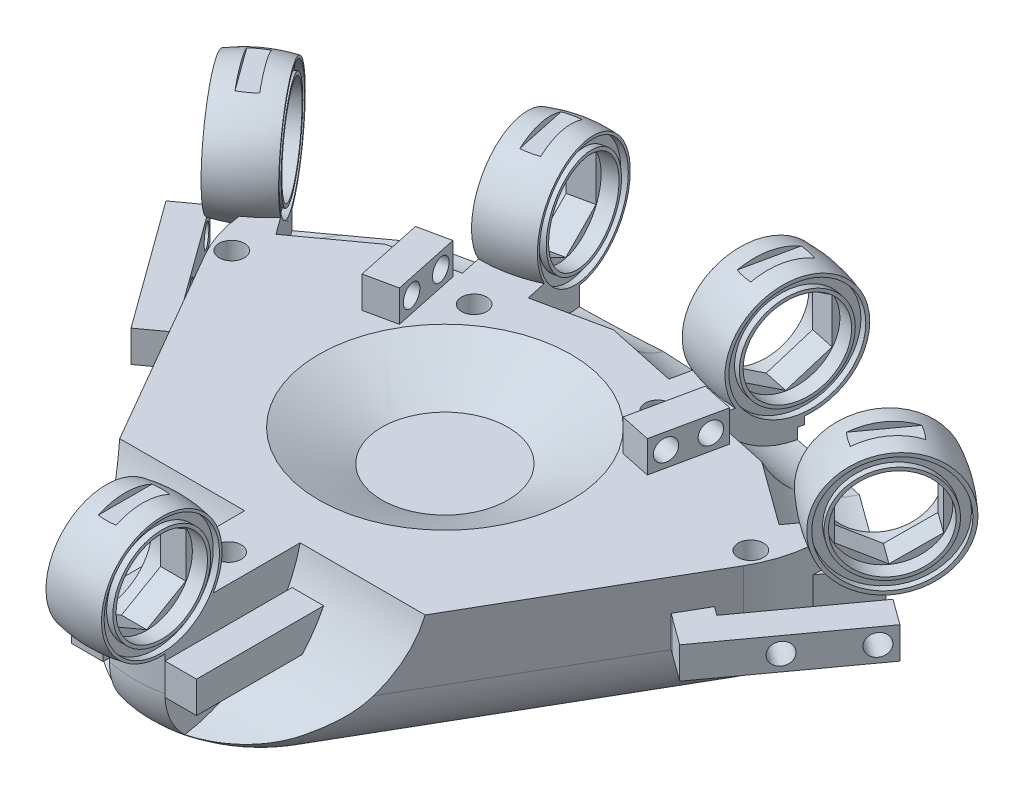
from build123d import *

# Parameters (mm, degrees)
BOSS_EXTRUDE1_DEPTH       = 20
FILLET1_R                 = 10
CUT_EXTRUDE1_DEPTH        = 15
CUT_EXTRUDE1_DEPTH_BACK   = 15
SKETCH6_R                 = 7.25
SKETCH12_R                = 12.5
CUT_EXTRUDE4_DEPTH        = 15
SKETCH13_R                = 9.15
SKETCH13_R_2              = 7.75
CUT_EXTRUDE5_DEPTH        = 1
CUT_EXTRUDE6_START        = -1
SKETCH14_R                = 9.15
SKETCH14_R_2              = 7.75
CUT_EXTRUDE6_DEPTH        = 1
SKETCH18_R                = 7.25
CUT_EXTRUDE7_DEPTH        = 10
SKETCH19_R                = 12.5
CUT_EXTRUDE8_DEPTH        = 15
CUT_EXTRUDE9_START        = 15
SKETCH20_R                = 12.5
CUT_EXTRUDE9_DEPTH        = 15
CUT_EXTRUDE10_DEPTH       = 10
CUT_EXTRUDE10_DEPTH_BACK  = 10
SKETCH22_R                = 7.25
SKETCH23_R                = 9.15
SKETCH23_R_2              = 7.75
CUT_EXTRUDE11_DEPTH       = 1
SKETCH24_R                = 9.45
SKETCH24_R_2              = 8.05
CUT_EXTRUDE12_DEPTH       = 1
SKETCH25_R                = 12.5
CUT_EXTRUDE13_DEPTH       = 15
CUT_EXTRUDE14_START       = 15
SKETCH26_R                = 12.5
CUT_EXTRUDE14_DEPTH       = 15
SKETCH27_R                = 9.15
SKETCH27_R_2              = 7.75
CUT_EXTRUDE15_DEPTH       = 1
SKETCH28_R                = 9.45
SKETCH28_R_2              = 8.05
CUT_EXTRUDE16_DEPTH       = 1
SKETCH31_R                = 9.15
SKETCH31_R_2              = 7.75
CUT_EXTRUDE17_DEPTH       = 1
CUT_EXTRUDE18_DEPTH       = 10
CUT_EXTRUDE18_DEPTH_BACK  = 10
SKETCH32_R                = 7.25
CUT_EXTRUDE19_START       = -1
SKETCH33_R                = 9.15
SKETCH33_R_2              = 7.75
CUT_EXTRUDE19_DEPTH       = 1
SKETCH36_R                = 12.5
CUT_EXTRUDE21_DEPTH       = 15
CUT_EXTRUDE22_DEPTH       = 10
CUT_EXTRUDE22_DEPTH_BACK  = 10
SKETCH37_R                = 7.25
SKETCH38_R                = 9.15
SKETCH38_R_2              = 7.75
CUT_EXTRUDE23_DEPTH       = 1
SKETCH39_R                = 9.45
SKETCH39_R_2              = 8.05
CUT_EXTRUDE24_DEPTH       = 1
SKETCH40_R                = 22.5
CUT_EXTRUDE25_DEPTH       = 20
SKETCH44_R                = 2
CUT_EXTRUDE27_DEPTH       = 20
SKETCH47_W                = 32.930294651
SKETCH47_H                = 15.901630763
CUT_EXTRUDE28_DEPTH       = 10
SKETCH48_W                = 41.253065482
SKETCH48_H                = 17.246321063
CUT_EXTRUDE29_DEPTH       = 10
SKETCH49_W                = 33.439654436
SKETCH49_H                = 19.134308239
CUT_EXTRUDE30_DEPTH       = 10
SKETCH50_W                = 28.57046848
SKETCH50_H                = 25.068795464
CUT_EXTRUDE31_DEPTH       = 10
SKETCH51_W                = 15
SKETCH51_H                = 2.5
BOSS_EXTRUDE2_DEPTH       = 40
SKETCH56_W                = 5
SKETCH56_H                = 5
BOSS_EXTRUDE6_DEPTH       = 25
SKETCH57_W                = 5
SKETCH57_H                = 5
BOSS_EXTRUDE7_DEPTH       = 5
SKETCH59_R                = 1.7
CUT_EXTRUDE33_DEPTH       = 5
BOSS_EXTRUDE10_DEPTH      = 2
BOSS_EXTRUDE10_DEPTH_BACK = 2
SKETCH62_R                = 7.25
BOSS_EXTRUDE11_DEPTH      = 2
BOSS_EXTRUDE11_DEPTH_BACK = 2
SKETCH63_R                = 7.25
BOSS_EXTRUDE12_DEPTH      = 2
BOSS_EXTRUDE12_DEPTH_BACK = 2
SKETCH64_R                = 7.25
CUT_EXTRUDE26_START       = 20
SKETCH41_R                = 22.5
CUT_EXTRUDE26_DEPTH       = 20
SKETCH60_W                = 5
SKETCH60_H                = 5
BOSS_EXTRUDE9_DEPTH       = 25
SKETCH65_R                = 1.5
CUT_EXTRUDE35_DEPTH       = 5
BOSS_EXTRUDE13_DEPTH      = 5
SKETCH67_R                = 1.7
CUT_EXTRUDE36_DEPTH       = 5
SKETCH61_R                = 1.5
CUT_EXTRUDE34_DEPTH       = 10
BOSS_EXTRUDE15_DEPTH      = 10
SKETCH71_W                = 5
SKETCH71_H                = 5
BOSS_EXTRUDE16_DEPTH      = 25
SKETCH72_W                = 5
SKETCH72_H                = 5
BOSS_EXTRUDE17_DEPTH      = 5
SKETCH73_R                = 1.7
CUT_EXTRUDE37_DEPTH       = 5
BOSS_EXTRUDE18_DEPTH      = 2
BOSS_EXTRUDE18_DEPTH_BACK = 2
SKETCH74_R                = 7.25
BOSS_EXTRUDE19_DEPTH      = 2
BOSS_EXTRUDE19_DEPTH_BACK = 2
SKETCH75_R                = 7.25
SKETCH77_W                = 2.8
SKETCH77_H                = 10
CUT_EXTRUDE38_DEPTH       = 1


with BuildPart() as part:
    # Sketch1 → Boss-Extrude1 (new body)
    with BuildSketch(Plane(origin=(0, 0, 0), x_dir=(1, 0, 0), z_dir=(0, 1, 0))):
        with BuildLine():
            Line((34.641016151, 0), (85.358983849, 0))
            ThreePointArc((85.358983849, 0), (102.679491924, -10), (102.679491924, -30))
            Line((102.679491924, -30), (77.320508076, -73.923048454))
            ThreePointArc((77.320508076, -73.923048454), (60, -83.923048454), (42.679491924, -73.923048454))
            Line((42.679491924, -73.923048454), (17.320508076, -30))
            ThreePointArc((17.320508076, -30), (17.320508076, -10), (34.641016151, 0))
        make_face()
    extrude(amount=BOSS_EXTRUDE1_DEPTH)

    # Fillet1
    fillet1_edges = [part.edges().sort_by_distance(p)[0] for p in [
        (30, 0, 51.961524227),
        (17.320508076, 0, 10),
        (60, 0, 0),
        (102.679491924, 0, 10),
        (90, 0, 51.961524227),
        (60, 0, 83.923048454),
    ]]
    fillet(fillet1_edges, radius=FILLET1_R)

    # Cut-Loft1: read off the stored shape, not the designer's step
    # Cut-Loft1: loft between two sections, ruled curve by curve
    cut_loft1_from = [
        Edge.make_bspline([(50.072678412, 15, 33.437568563), (47.665783236, 15, 53.292211738), (67.520426411, 15, 55.699106915), (69.927321588, 15, 35.844463739), (72.334216764, 15, 15.989820564), (52.479573589, 15, 13.582925388), (50.072678412, 15, 33.437568563)], [0, 0, 0, 0, 0.5, 0.5, 0.5, 1, 1, 1, 1], 3, [1, 0.333333333, 0.333333333, 1, 0.333333333, 0.333333333, 1]),
    ]
    cut_loft1_to = [
        Edge.make_bspline([(41.957320813, 20, 26.011895238), (24.699078985, 20, 62.097253612), (60.78443736, 20, 79.35549544), (78.042679187, 20, 43.270137065), (95.300921015, 20, 7.18477869), (59.21556264, 20, -10.073463137), (41.957320813, 20, 26.011895238)], [0, 0, 0, 0, 0.5, 0.5, 0.5, 1, 1, 1, 1], 3, [1, 0.333333333, 0.333333333, 1, 0.333333333, 0.333333333, 1]),
    ]
    cut_loft1 = Solid(Shell([*[Face.make_surface_from_curves(cut_loft1_from[k], cut_loft1_to[k]) for k in range(1)], Face(Wire(cut_loft1_from)), Face(Wire(cut_loft1_to))]))
    add(cut_loft1, mode=Mode.SUBTRACT)

    # Sketch5 → Revolve1 (revolve)
    with BuildSketch(Plane(origin=(22.309350243, 0, 5.797401883), x_dir=(-0.8090169943749479, 0, 0.5877852522924724), z_dir=(-0.5877852522924725, 0, -0.809016994374948))):
        with BuildLine():
            Line((11.028726698, 25), (19.828726698, 25))
            Line((19.828726698, 25), (19.828726698, 34.539392014))
            add(Edge.make_bspline(
                [(19.828726698, 34.539392014), (15.428726698, 35.441382878), (11.028726698, 34.539392014)],
                knots=[1.272475926, 1.272475926, 1.272475926, 1.869116728, 1.869116728, 1.869116728], degree=2, weights=[1, 0.955831497, 1]))
            Line((11.028726698, 34.539392014), (11.028726698, 25))
        make_face()
    revolve(axis=Axis((13.386922918, 25, 12.279924788), (-0.809016994374948, 0, 0.5877852522924724)))

    # Sketch6 → Cut-Extrude1 (cut, two sides: drawn at the far end of the back side and taken through both)
    with BuildSketch(Plane(origin=(-0.637271219, 0, 0.463004642), x_dir=(-0.5877852522924727, 0, -0.8090169943749477), z_dir=(0.8090169943749477, 0, -0.5877852522924727)).offset(-CUT_EXTRUDE1_DEPTH_BACK)):
        with Locations(Location((-17.803303708, 25, 0), (0, 0, 223.602818973))):
            Circle(SKETCH6_R)
    extrude(amount=CUT_EXTRUDE1_DEPTH + CUT_EXTRUDE1_DEPTH_BACK, mode=Mode.SUBTRACT)

    # Sketch12 → Cut-Extrude4 (cut)
    with BuildSketch(Plane(origin=(2.922403557, 0, -2.123250468), x_dir=(-0.5877852522924724, 0, -0.809016994374948), z_dir=(0.809016994374948, 0, -0.5877852522924724))):
        with Locations((-17.803303708, 25)):
            Circle(SKETCH12_R)
    extrude(amount=CUT_EXTRUDE4_DEPTH, mode=Mode.SUBTRACT)

    # Sketch13 → Cut-Extrude5 (cut)
    with BuildSketch(Plane(origin=(-4.196945994, 0, 3.049259752), x_dir=(0.5877852522924724, 0, 0.809016994374948), z_dir=(-0.809016994374948, 0, 0.5877852522924724))):
        with Locations((17.803303708, 25)):
            Circle(SKETCH13_R)
        with Locations((17.803303708, 25)):
            Circle(SKETCH13_R_2, mode=Mode.SUBTRACT)
    extrude(amount=-CUT_EXTRUDE5_DEPTH, mode=Mode.SUBTRACT)

    # Sketch14 → Cut-Extrude6 (cut)
    with BuildSketch(Plane(origin=(2.922403557, 0, -2.123250468), x_dir=(-0.5877852522924724, 0, -0.809016994374948), z_dir=(0.809016994374948, 0, -0.5877852522924724)).offset(CUT_EXTRUDE6_START)):
        with Locations(Location((-17.803303708, 25, 0), (0, 0, 180))):
            Circle(SKETCH14_R)
        with Locations(Location((-17.803303708, 25, 0), (0, 0, 180))):
            Circle(SKETCH14_R_2, mode=Mode.SUBTRACT)
    extrude(amount=CUT_EXTRUDE6_DEPTH, mode=Mode.SUBTRACT)

    # Sketch17 → Revolve3 (revolve)
    with BuildSketch(Plane(origin=(1.822531149, 0, 8.574334919), x_dir=(-0.9781476007338061, 0, 0.20791169081775784), z_dir=(-0.20791169081775784, 0, -0.9781476007338061))):
        with BuildLine():
            Line((-45.640273141, 25), (-36.840273141, 25))
            Line((-36.840273141, 25), (-36.840273141, 34.560102277))
            add(Edge.make_bspline(
                [(-36.840273141, 34.560102277), (-41.240273141, 35.460139138), (-45.640273141, 34.560102277)],
                knots=[1.273084632, 1.273084632, 1.273084632, 1.868508022, 1.868508022, 1.868508022], degree=2, weights=[1, 0.956010228, 1]))
            Line((-45.640273141, 34.560102277), (-45.640273141, 25))
        make_face()
    revolve(axis=Axis((46.465454819, 25, -0.91481144), (-0.978147600733806, 0, 0.20791169081775793)))

    # Sketch18 → Cut-Extrude7 (cut)
    with BuildSketch(Plane(origin=(36.035224784, 0, -7.659523479), x_dir=(0.2079116908177577, 0, 0.978147600733806), z_dir=(-0.978147600733806, 0, 0.2079116908177577))):
        with Locations(Location((8.765890661, 25, 0), (0, 0, 316.397181027))):
            Circle(SKETCH18_R)
    extrude(amount=-CUT_EXTRUDE7_DEPTH, mode=Mode.SUBTRACT)

    # Sketch19 → Cut-Extrude8 (cut)
    with BuildSketch(Plane(origin=(44.64292367, 0, -9.489146358), x_dir=(-0.2079116908177577, 0, -0.978147600733806), z_dir=(0.978147600733806, 0, -0.2079116908177577))):
        with Locations((-8.765890661, 25)):
            Circle(SKETCH19_R)
    extrude(amount=CUT_EXTRUDE8_DEPTH, mode=Mode.SUBTRACT)

    # Sketch20 → Cut-Extrude9 (cut)
    with BuildSketch(Plane(origin=(36.035224784, 0, -7.659523479), x_dir=(0.2079116908177577, 0, 0.978147600733806), z_dir=(-0.978147600733806, 0, 0.2079116908177577)).offset(CUT_EXTRUDE9_START)):
        with Locations((8.765890661, 25)):
            Circle(SKETCH20_R)
    extrude(amount=-CUT_EXTRUDE9_DEPTH, mode=Mode.SUBTRACT)

    # Sketch21 → Revolve4 (revolve)
    with BuildSketch(Plane(origin=(3.364741393, 0, -15.829863666), x_dir=(-0.9781476007338051, 0, -0.2079116908177618), z_dir=(0.2079116908177618, 0, -0.9781476007338051))):
        with BuildLine():
            Line((-80.537438947, 25), (-71.737438947, 25))
            Line((-71.737438947, 25), (-71.737438947, 34.677856787))
            add(Edge.make_bspline(
                [(-71.737438947, 34.677856787), (-76.137438947, 35.332866274), (-80.537438947, 34.677856787)],
                knots=[1.316281954, 1.316281954, 1.316281954, 1.8253107, 1.8253107, 1.8253107], degree=2, weights=[1, 0.967785679, 1]))
            Line((-80.537438947, 34.677856787), (-80.537438947, 25))
        make_face()
    revolve(axis=Axis((82.142244068, 25, 0.91481144), (-0.9781476007338051, 0, -0.20791169081776173)))

    # Sketch22 → Cut-Extrude10 (cut, two sides: drawn at the far end of the back side and taken through both)
    with BuildSketch(Plane(origin=(74.473653232, 0, 15.829863666), x_dir=(0.20791169081776434, 0, -0.9781476007338046), z_dir=(0.9781476007338046, 0, 0.20791169081776434)).offset(-CUT_EXTRUDE10_DEPTH_BACK)):
        with Locations(Location((16.183512237, 25, 0), (0, 0, 223.602818973))):
            Circle(SKETCH22_R)
    extrude(amount=CUT_EXTRUDE10_DEPTH + CUT_EXTRUDE10_DEPTH_BACK, mode=Mode.SUBTRACT)

    # Sketch23 → Cut-Extrude11 (cut)
    with BuildSketch(Plane(origin=(78.777502675, 0, 16.744675106), x_dir=(0.20791169081776179, 0, -0.9781476007338052), z_dir=(0.9781476007338052, 0, 0.20791169081776179))):
        with Locations((16.183512237, 25)):
            Circle(SKETCH23_R)
        with Locations((16.183512237, 25)):
            Circle(SKETCH23_R_2, mode=Mode.SUBTRACT)
    extrude(amount=-CUT_EXTRUDE11_DEPTH, mode=Mode.SUBTRACT)

    # Sketch24 → Cut-Extrude12 (cut)
    with BuildSketch(Plane(origin=(70.169803789, 0, 14.915052226), x_dir=(-0.20791169081776179, 0, 0.9781476007338052), z_dir=(-0.9781476007338052, 0, -0.20791169081776179))):
        with Locations((-16.183512237, 25)):
            Circle(SKETCH24_R)
        with Locations((-16.183512237, 25)):
            Circle(SKETCH24_R_2, mode=Mode.SUBTRACT)
    extrude(amount=-CUT_EXTRUDE12_DEPTH, mode=Mode.SUBTRACT)

    # Sketch25 → Cut-Extrude13 (cut)
    with BuildSketch(Plane(origin=(78.777502675, 0, 16.744675106), x_dir=(0.20791169081776179, 0, -0.9781476007338052), z_dir=(0.9781476007338052, 0, 0.20791169081776179))):
        with Locations((16.183512237, 25)):
            Circle(SKETCH25_R)
    extrude(amount=CUT_EXTRUDE13_DEPTH, mode=Mode.SUBTRACT)

    # Sketch26 → Cut-Extrude14 (cut)
    with BuildSketch(Plane(origin=(70.169803789, 0, 14.915052226), x_dir=(-0.20791169081776179, 0, 0.9781476007338052), z_dir=(-0.9781476007338052, 0, -0.20791169081776179)).offset(CUT_EXTRUDE14_START)):
        with Locations((-16.183512237, 25)):
            Circle(SKETCH26_R)
    extrude(amount=-CUT_EXTRUDE14_DEPTH, mode=Mode.SUBTRACT)

    # Sketch27 → Cut-Extrude15 (cut)
    with BuildSketch(Plane(origin=(44.64292367, 0, -9.489146358), x_dir=(-0.2079116908177577, 0, -0.978147600733806), z_dir=(0.978147600733806, 0, -0.2079116908177577))):
        with Locations((-8.765890661, 25)):
            Circle(SKETCH27_R)
        with Locations((-8.765890661, 25)):
            Circle(SKETCH27_R_2, mode=Mode.SUBTRACT)
    extrude(amount=-CUT_EXTRUDE15_DEPTH, mode=Mode.SUBTRACT)

    # Sketch28 → Cut-Extrude16 (cut)
    with BuildSketch(Plane(origin=(36.035224784, 0, -7.659523479), x_dir=(0.2079116908177577, 0, 0.978147600733806), z_dir=(-0.978147600733806, 0, 0.2079116908177577))):
        with Locations((8.765890661, 25)):
            Circle(SKETCH28_R)
        with Locations((8.765890661, 25)):
            Circle(SKETCH28_R_2, mode=Mode.SUBTRACT)
    extrude(amount=-CUT_EXTRUDE16_DEPTH, mode=Mode.SUBTRACT)

    # Sketch29 → Revolve5 (revolve)
    with BuildSketch(Plane(origin=(30.994460976, 0, -42.660215722), x_dir=(-0.8090169943749453, 0, -0.5877852522924761), z_dir=(0.587785252292476, 0, -0.8090169943749452))):
        with BuildLine():
            Line((-102.269749871, 25), (-93.469749871, 25))
            Line((-93.469749871, 25), (-93.469749871, 34.726608055))
            add(Edge.make_bspline(
                [(-93.469749871, 34.726608055), (-97.869749871, 35.281076346), (-102.269749871, 34.726608055)],
                knots=[1.336426181, 1.336426181, 1.336426181, 1.805166473, 1.805166473, 1.805166473], degree=2, weights=[1, 0.972660805, 1]))
            Line((-102.269749871, 34.726608055), (-102.269749871, 25))
        make_face()
    revolve(axis=Axis((113.732426632, 25, 17.452435008), (-0.8090169943749456, 0, -0.5877852522924758)))

    # Sketch31 → Cut-Extrude17 (cut)
    with BuildSketch(Plane(origin=(82.737965656, 0, 60.11265073), x_dir=(0.5877852522924765, 0, -0.8090169943749451), z_dir=(0.8090169943749451, 0, 0.5877852522924765))):
        with Locations((52.730926567, 25)):
            Circle(SKETCH31_R)
        with Locations((52.730926567, 25)):
            Circle(SKETCH31_R_2, mode=Mode.SUBTRACT)
    extrude(amount=-CUT_EXTRUDE17_DEPTH, mode=Mode.SUBTRACT)

    # Sketch32 → Cut-Extrude18 (cut, two sides: drawn at the far end of the back side and taken through both)
    with BuildSketch(Plane(origin=(79.178290881, 0, 57.52639562), x_dir=(0.5877852522924766, 0, -0.8090169943749451), z_dir=(0.8090169943749451, 0, 0.5877852522924766)).offset(-CUT_EXTRUDE18_DEPTH_BACK)):
        with Locations(Location((52.730926567, 25, 0), (0, 0, 180))):
            Circle(SKETCH32_R)
    extrude(amount=CUT_EXTRUDE18_DEPTH + CUT_EXTRUDE18_DEPTH_BACK, mode=Mode.SUBTRACT)

    # Sketch33 → Cut-Extrude19 (cut)
    with BuildSketch(Plane(origin=(75.618616106, 0, 54.94014051), x_dir=(-0.5877852522924765, 0, 0.8090169943749451), z_dir=(-0.8090169943749451, 0, -0.5877852522924765)).offset(CUT_EXTRUDE19_START)):
        with Locations(Location((-52.730926567, 25, 0), (0, 0, 180))):
            Circle(SKETCH33_R)
        with Locations(Location((-52.730926567, 25, 0), (0, 0, 180))):
            Circle(SKETCH33_R_2, mode=Mode.SUBTRACT)
    extrude(amount=CUT_EXTRUDE19_DEPTH, mode=Mode.SUBTRACT)

    # Sketch34 → Revolve6 (revolve)
    with BuildSketch(Plane.XY.offset(83.923048454)):
        with BuildLine():
            Line((55.6, 25), (64.4, 25))
            Line((64.4, 25), (64.4, 34.560102277))
            add(Edge.make_bspline(
                [(64.4, 34.560102277), (60, 35.460139138), (55.6, 34.560102277)],
                knots=[1.273084632, 1.273084632, 1.273084632, 1.868508022, 1.868508022, 1.868508022], degree=2, weights=[1, 0.956010228, 1]))
            Line((55.6, 34.560102277), (55.6, 25))
        make_face()
    revolve(axis=Axis((55.6, 25, 83.923048454), (1, 0, 0)))

    # Sketch36 → Cut-Extrude21 (cut)
    with BuildSketch(Plane(origin=(75.618616106, 0, 54.94014051), x_dir=(-0.5877852522924765, 0, 0.8090169943749451), z_dir=(-0.8090169943749451, 0, -0.5877852522924765))):
        with Locations((-52.730926567, 25)):
            Circle(SKETCH36_R)
    extrude(amount=CUT_EXTRUDE21_DEPTH, mode=Mode.SUBTRACT)

    # Sketch37 → Cut-Extrude22 (cut, two sides: drawn at the far end of the back side and taken through both)
    with BuildSketch(Plane(origin=(60, 0, 0), x_dir=(0, 0, -1), z_dir=(1, 0, 0)).offset(-CUT_EXTRUDE22_DEPTH_BACK)):
        with Locations(Location((-83.923048454, 25, 0), (0, 0, 291.690031176))):
            Circle(SKETCH37_R)
    extrude(amount=CUT_EXTRUDE22_DEPTH + CUT_EXTRUDE22_DEPTH_BACK, mode=Mode.SUBTRACT)

    # Sketch38 → Cut-Extrude23 (cut)
    with BuildSketch(Plane(origin=(64.4, 0, 0), x_dir=(0, 0, -1), z_dir=(1, 0, 0))):
        with Locations((-83.923048454, 25)):
            Circle(SKETCH38_R)
        with Locations((-83.923048454, 25)):
            Circle(SKETCH38_R_2, mode=Mode.SUBTRACT)
    extrude(amount=-CUT_EXTRUDE23_DEPTH, mode=Mode.SUBTRACT)

    # Sketch39 → Cut-Extrude24 (cut)
    with BuildSketch(Plane.ZY.offset(-55.6)):
        with Locations((83.923048454, 25)):
            Circle(SKETCH39_R)
        with Locations((83.923048454, 25)):
            Circle(SKETCH39_R_2, mode=Mode.SUBTRACT)
    extrude(amount=-CUT_EXTRUDE24_DEPTH, mode=Mode.SUBTRACT)

    # Sketch40 → Cut-Extrude25 (cut)
    with BuildSketch(Plane.ZY.offset(-55.6)):
        with Locations((83.923048454, 25)):
            Circle(SKETCH40_R)
    extrude(amount=CUT_EXTRUDE25_DEPTH, mode=Mode.SUBTRACT)

    # Sketch44 → Cut-Extrude27 (cut)
    with BuildSketch(Plane(origin=(0, 20, 0), x_dir=(1, 0, 0), z_dir=(0, 1, 0))):
        with Locations(Location((18.85503234, -27.291858848, 0), (0, 0, 270))):
            Circle(SKETCH44_R)
        with Locations(Location((45.446181643, -15.452716403, 0), (0, 0, 270))):
            Circle(SKETCH44_R)
        with Locations(Location((74.553818357, -15.452716403, 0), (0, 0, 270))):
            Circle(SKETCH44_R)
        with Locations(Location((101.14496766, -27.291858848, 0), (0, 0, 270))):
            Circle(SKETCH44_R)
        with Locations(Location((60, -68.923048454, 0), (0, 0, 270))):
            Circle(SKETCH44_R)
    extrude(amount=-CUT_EXTRUDE27_DEPTH, mode=Mode.SUBTRACT)

    # Sketch47 → Cut-Extrude28 (cut)
    with BuildSketch(Plane(origin=(10.464519362, 0, 14.403175256), x_dir=(-0.8090169943749479, 0, 0.5877852522924724), z_dir=(-0.5877852522924725, 0, -0.809016994374948))):
        with Locations((-11.17743678, 6.150818119)):
            Rectangle(SKETCH47_W, SKETCH47_H)
    extrude(amount=CUT_EXTRUDE28_DEPTH, mode=Mode.SUBTRACT)

    # Sketch48 → Cut-Extrude29 (cut)
    with BuildSketch(Plane(origin=(30.994460976, 0, -42.660215722), x_dir=(-0.8090169943749453, 0, -0.5877852522924761), z_dir=(0.587785252292476, 0, -0.8090169943749452))):
        with Locations((-86.490907547, 5.876824443)):
            Rectangle(SKETCH48_W, SKETCH48_H)
    extrude(amount=CUT_EXTRUDE29_DEPTH, mode=Mode.SUBTRACT)

    # Sketch49 → Cut-Extrude30 (cut)
    with BuildSketch(Plane(origin=(3.364741393, 0, -15.829863666), x_dir=(-0.9781476007338051, 0, -0.2079116908177618), z_dir=(0.2079116908177618, 0, -0.9781476007338051))):
        with Locations((-79.088973858, 4.616639798)):
            Rectangle(SKETCH49_W, SKETCH49_H)
    extrude(amount=CUT_EXTRUDE30_DEPTH, mode=Mode.SUBTRACT)

    # Sketch50 → Cut-Extrude31 (cut)
    with BuildSketch(Plane(origin=(1.822531149, 0, 8.574334919), x_dir=(-0.9781476007338061, 0, 0.20791169081775784), z_dir=(-0.20791169081775784, 0, -0.9781476007338061))):
        with Locations((-34.926731721, 2.021969218)):
            Rectangle(SKETCH50_W, SKETCH50_H)
    extrude(amount=CUT_EXTRUDE31_DEPTH, mode=Mode.SUBTRACT)

    # Sketch51 → Boss-Extrude2 (add)
    with BuildSketch(Plane(origin=(10.464519362, 0, 14.403175256), x_dir=(-0.8090169943749479, 0, 0.5877852522924724), z_dir=(-0.5877852522924725, 0, -0.809016994374948))):
        with Locations((-10.935114465, 11.25)):
            Rectangle(SKETCH51_W, SKETCH51_H)
    extrude(amount=-BOSS_EXTRUDE2_DEPTH)



with BuildPart() as body_2:
    # Sketch56 → Boss-Extrude6 (new body)
    with BuildSketch(Plane(origin=(30.994460976, 0, -42.660215722), x_dir=(-0.8090169943749453, 0, -0.5877852522924761), z_dir=(0.587785252292476, 0, -0.8090169943749452))):
        with Locations((-105.269749871, 12.5)):
            Rectangle(SKETCH56_W, SKETCH56_H)
    extrude(amount=-BOSS_EXTRUDE6_DEPTH)


with BuildPart() as part_1:
    add(part.part)

    add(body_2.part)  # Boss-Extrude7 merges body 2
    # Sketch57 → Boss-Extrude7 (add)
    with BuildSketch(Plane(origin=(83.142474154, 0, 60.406543356), x_dir=(-0.587785252292476, 0, 0.8090169943749453), z_dir=(-0.8090169943749453, 0, -0.587785252292476))):
        with Locations((-30.245630382, 12.5)):
            Rectangle(SKETCH57_W, SKETCH57_H)
    extrude(amount=BOSS_EXTRUDE7_DEPTH)

    # Sketch59 → Cut-Extrude33 (cut)
    with BuildSketch(Plane(origin=(87.187559125, 0, 63.345469618), x_dir=(0.587785252292476, 0, -0.8090169943749453), z_dir=(0.8090169943749453, 0, 0.587785252292476))):
        with Locations((50.230926567, 12.5)):
            Circle(SKETCH59_R)
        with Locations((39.230926567, 12.5)):
            Circle(SKETCH59_R)
    extrude(amount=-CUT_EXTRUDE33_DEPTH, mode=Mode.SUBTRACT)

    # Sketch62 → Boss-Extrude10 (add, two sides: drawn at the far end of the back side and taken through both)
    with BuildSketch(Plane(origin=(60, 0, 0), x_dir=(0, 0, -1), z_dir=(1, 0, 0)).offset(-BOSS_EXTRUDE10_DEPTH_BACK)):
        with Locations((-83.923048454, 25)):
            Circle(SKETCH62_R)
        Polygon((-83.923048454, 17.840856662), (-77.723048454, 21.420428331), (-77.723048454, 28.579571669), (-83.923048454, 32.159143338), (-90.123048454, 28.579571669), (-90.123048454, 21.420428331), align=None, mode=Mode.SUBTRACT)
    extrude(amount=BOSS_EXTRUDE10_DEPTH + BOSS_EXTRUDE10_DEPTH_BACK)

    # Sketch63 → Boss-Extrude11 (add, two sides: drawn at the far end of the back side and taken through both)
    with BuildSketch(Plane(origin=(40.339074227, 0, -8.574334919), x_dir=(-0.20791169081775984, 0, -0.9781476007338056), z_dir=(0.9781476007338056, 0, -0.20791169081775984)).offset(-BOSS_EXTRUDE11_DEPTH_BACK)):
        with Locations((-8.765890661, 25)):
            Circle(SKETCH63_R)
        Polygon((-8.765890661, 17.840856662), (-2.565890661, 21.420428331), (-2.565890661, 28.579571669), (-8.765890661, 32.159143338), (-14.965890661, 28.579571669), (-14.965890661, 21.420428331), align=None, mode=Mode.SUBTRACT)
    extrude(amount=BOSS_EXTRUDE11_DEPTH + BOSS_EXTRUDE11_DEPTH_BACK)

    # Sketch64 → Boss-Extrude12 (add, two sides: drawn at the far end of the back side and taken through both)
    with BuildSketch(Plane(origin=(-0.637271219, 0, 0.463004642), x_dir=(-0.5877852522924727, 0, -0.8090169943749477), z_dir=(0.8090169943749477, 0, -0.5877852522924727)).offset(-BOSS_EXTRUDE12_DEPTH_BACK)):
        with Locations((-17.803303708, 25)):
            Circle(SKETCH64_R)
        Polygon((-17.803303708, 17.840856662), (-11.603303708, 21.420428331), (-11.603303708, 28.579571669), (-17.803303708, 32.159143338), (-24.003303708, 28.579571669), (-24.003303708, 21.420428331), align=None, mode=Mode.SUBTRACT)
    extrude(amount=BOSS_EXTRUDE12_DEPTH + BOSS_EXTRUDE12_DEPTH_BACK)

    # Sketch41 → Cut-Extrude26 (cut)
    with BuildSketch(Plane(origin=(64.4, 0, 0), x_dir=(0, 0, -1), z_dir=(1, 0, 0)).offset(CUT_EXTRUDE26_START)):
        with Locations((-83.923048454, 25)):
            Circle(SKETCH41_R)
    extrude(amount=-CUT_EXTRUDE26_DEPTH, mode=Mode.SUBTRACT)

    # Sketch60 → Boss-Extrude9 (add)
    with BuildSketch(Plane.XY.offset(83.923048454)):
        with Locations((52.6, 12.5)):
            Rectangle(SKETCH60_W, SKETCH60_H)
    boss_extrude9 = extrude(amount=-BOSS_EXTRUDE9_DEPTH)

    # Sketch65 → Cut-Extrude35 (cut)
    with BuildSketch(Plane.ZY.offset(-50.1)):
        with Locations((81.423048454, 12.5)):
            Circle(SKETCH65_R)
        with Locations((70.423048454, 12.5)):
            Circle(SKETCH65_R)
    extrude(amount=-CUT_EXTRUDE35_DEPTH, mode=Mode.SUBTRACT)

    # Sketch66 → Boss-Extrude13 (add)
    with BuildSketch(Plane(origin=(0, 20, 0), x_dir=(1, 0, 0), z_dir=(0, 1, 0))):
        Polygon((39.993866463, -13.369288531), (35.103128459, -14.408846985), (37.390157058, -25.168470593), (42.280895062, -24.128912139), align=None)
    boss_extrude13 = extrude(amount=BOSS_EXTRUDE13_DEPTH)

    # Sketch67 → Cut-Extrude36 (cut)
    with BuildSketch(Plane(origin=(35.546150983, 0, -7.555567634), x_dir=(-0.2079116908178822, 0, -0.9781476007337795), z_dir=(0.9781476007337795, 0, -0.2079116908178822))):
        with Locations((-29.892329899, 22.5)):
            Circle(SKETCH67_R)
        with Locations((-23.892329899, 22.5)):
            Circle(SKETCH67_R)
    cut_extrude36 = extrude(amount=-CUT_EXTRUDE36_DEPTH, mode=Mode.SUBTRACT)

    # Sketch61 → Cut-Extrude34 (cut)
    with BuildSketch(Plane.XZ):
        with Locations(Location((60, 54.641016151, 0), (0, 0, 270))):
            Circle(SKETCH61_R)
        with Locations(Location((80, 34.641016151, 0), (0, 0, 270))):
            Circle(SKETCH61_R)
        with Locations(Location((60, 14.641016151, 0), (0, 0, 270))):
            Circle(SKETCH61_R)
        with Locations(Location((40, 34.641016151, 0), (0, 0, 270))):
            Circle(SKETCH61_R)
    extrude(amount=-CUT_EXTRUDE34_DEPTH, mode=Mode.SUBTRACT)

    # Sketch70 → Boss-Extrude15 (add)
    with BuildSketch(Plane(origin=(30.994460976, 0, -42.660215722), x_dir=(-0.8090169943749453, 0, -0.5877852522924761), z_dir=(0.587785252292476, 0, -0.8090169943749452))):
        Polygon((-93.469749871, 15.273391945), (-93.469749871, 10), (-97.866676059, 10), (-97.866676059, 15.273391945), (-97.866676059, 15.85), (-93.469749871, 15.85), align=None)
    boss_extrude15 = extrude(amount=-BOSS_EXTRUDE15_DEPTH)

    # Mirror5: Boss-Extrude9, Boss-Extrude13, Cut-Extrude36, Boss-Extrude15 across plane
    add(boss_extrude9.mirror(Plane(origin=(60, 0, 0), x_dir=(0, 0, 1), z_dir=(1, 0, 0))))
    add(boss_extrude13.mirror(Plane(origin=(60, 0, 0), x_dir=(0, 0, 1), z_dir=(1, 0, 0))))
    add(cut_extrude36.mirror(Plane(origin=(60, 0, 0), x_dir=(0, 0, 1), z_dir=(1, 0, 0))), mode=Mode.SUBTRACT)
    add(boss_extrude15.mirror(Plane(origin=(60, 0, 0), x_dir=(0, 0, 1), z_dir=(1, 0, 0))))



with BuildPart() as body_2_2:
    # Sketch71 → Boss-Extrude16 (new body)
    with BuildSketch(Plane(origin=(10.464519362, 0, 14.403175256), x_dir=(-0.8090169943749479, 0, 0.5877852522924724), z_dir=(-0.5877852522924725, 0, -0.809016994374948))):
        with Locations((8.187710546, 12.5)):
            Rectangle(SKETCH71_W, SKETCH71_H)
    extrude(amount=-BOSS_EXTRUDE16_DEPTH)


with BuildPart() as part_2:
    add(part_1.part)

    add(body_2_2.part)  # Boss-Extrude17 merges body 2 2
    # Sketch72 → Boss-Extrude17 (add)
    with BuildSketch(Plane(origin=(-4.601454491, 0, 3.343152378), x_dir=(-0.5877852522924724, 0, -0.809016994374948), z_dir=(0.809016994374948, 0, -0.5877852522924724))):
        with Locations((-40.303303708, 12.5)):
            Rectangle(SKETCH72_W, SKETCH72_H)
    extrude(amount=BOSS_EXTRUDE17_DEPTH)

    # Sketch73 → Cut-Extrude37 (cut)
    with BuildSketch(Plane(origin=(-8.646539463, 0, 6.28207864), x_dir=(0.5877852522924724, 0, 0.809016994374948), z_dir=(-0.809016994374948, 0, 0.5877852522924724))):
        with Locations((20.303303708, 12.5)):
            Circle(SKETCH73_R)
        with Locations((31.303303708, 12.5)):
            Circle(SKETCH73_R)
    extrude(amount=-CUT_EXTRUDE37_DEPTH, mode=Mode.SUBTRACT)

    # Sketch74 → Boss-Extrude18 (add, two sides: drawn at the far end of the back side and taken through both)
    with BuildSketch(Plane(origin=(79.178290881, 0, 57.52639562), x_dir=(0.5877852522924766, 0, -0.8090169943749451), z_dir=(0.8090169943749451, 0, 0.5877852522924766)).offset(-BOSS_EXTRUDE18_DEPTH_BACK)):
        with Locations((52.730926567, 25)):
            Circle(SKETCH74_R)
        Polygon((52.730926567, 32.159143338), (46.530926567, 28.579571669), (46.530926567, 21.420428331), (52.730926567, 17.840856662), (58.930926567, 21.420428331), (58.930926567, 28.579571669), align=None, mode=Mode.SUBTRACT)
    extrude(amount=BOSS_EXTRUDE18_DEPTH + BOSS_EXTRUDE18_DEPTH_BACK)

    # Sketch75 → Boss-Extrude19 (add, two sides: drawn at the far end of the back side and taken through both)
    with BuildSketch(Plane(origin=(74.473653232, 0, 15.829863666), x_dir=(0.20791169081776434, 0, -0.9781476007338046), z_dir=(0.9781476007338046, 0, 0.20791169081776434)).offset(-BOSS_EXTRUDE19_DEPTH_BACK)):
        with Locations((16.183512237, 25)):
            Circle(SKETCH75_R)
        Polygon((16.183512237, 17.840856662), (22.383512237, 21.420428331), (22.383512237, 28.579571669), (16.183512237, 32.159143338), (9.983512237, 28.579571669), (9.983512237, 21.420428331), align=None, mode=Mode.SUBTRACT)
    extrude(amount=BOSS_EXTRUDE19_DEPTH + BOSS_EXTRUDE19_DEPTH_BACK)

    # Sketch77 → Cut-Extrude38 (cut)
    with BuildSketch(Plane(origin=(0, 35, 0), x_dir=(1, 0, 0), z_dir=(0, 1, 0))):
        with Locations((60, -83.923048454)):
            Rectangle(SKETCH77_W, SKETCH77_H)
        Polygon((75.429429529, -4.599661637), (77.508546437, 5.181814371), (80.247359719, 4.599661637), (78.168242811, -5.181814371), align=None)
        Polygon((39.752640281, 4.599661637), (42.491453563, 5.181814371), (44.570570471, -4.599661637), (41.831757189, -5.181814371), align=None)
        Polygon((114.24430191, -11.643994279), (111.979054326, -9.998195573), (106.101201803, -18.088365517), (108.366449388, -19.734164223), align=None)
        Polygon((5.75569809, -11.643994279), (8.020945674, -9.998195573), (13.898798197, -18.088365517), (11.633550612, -19.734164223), align=None)
    extrude(amount=-CUT_EXTRUDE38_DEPTH, mode=Mode.SUBTRACT)


solid = part_2.part
